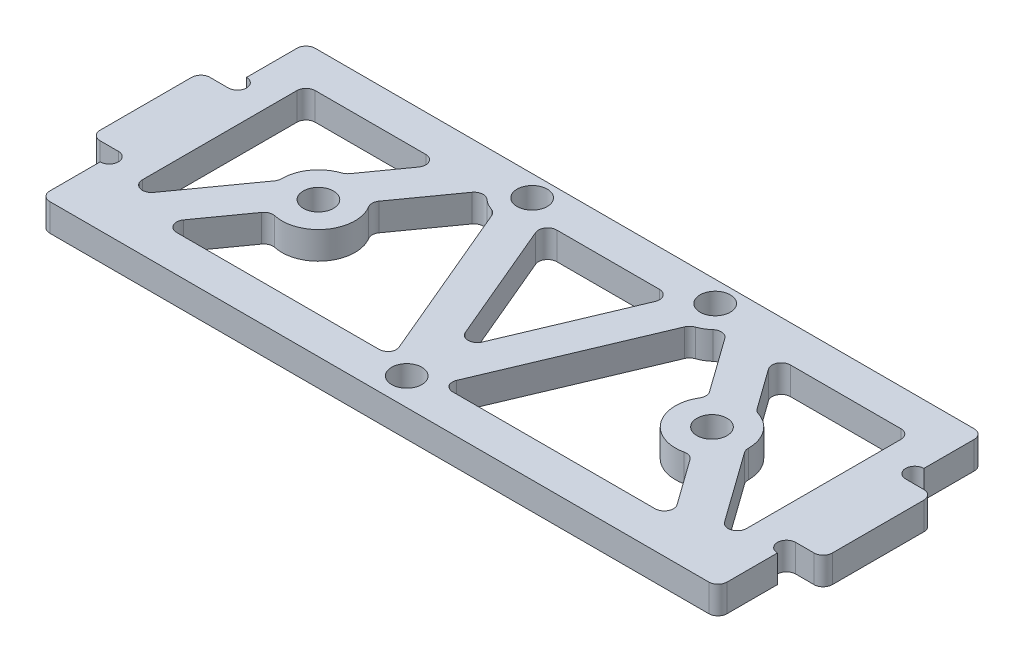
from build123d import *

# Parameters (mm, degrees)
SKETCH_3_R          = 1.65
EXTRUDE_6_DEPTH     = 3
SKETCH_4_R          = 1
CUT_EXTRUDE_1_DEPTH = 50.497474683
FILLET_1_R          = 1


with BuildPart() as part:
    # 草图3 → 凸台-拉伸6 (new body)
    with BuildSketch(Plane(origin=(0, 0, 0), x_dir=(1, 0, 0), z_dir=(0, 1, 0))):
        Polygon((-37, -20.5), (-40, -20.5), (-40, -8.5), (-37, -8.5), (-37, 0), (37, 0), (37, -8.5), (40, -8.5), (40, -20.5), (37, -20.5), (37, -29), (-37, -29), align=None)
        with Locations(Location((-10, -2.3, 0), (0, 0, 270))):
            Circle(SKETCH_3_R, mode=Mode.SUBTRACT)
        with Locations(Location((10, -2.3, 0), (0, 0, 270))):
            Circle(SKETCH_3_R, mode=Mode.SUBTRACT)
        with Locations(Location((0, -26, 0), (0, 0, 270))):
            Circle(SKETCH_3_R, mode=Mode.SUBTRACT)
        with Locations(Location((-21.5, -14.15, 0), (0, 0, 270))):
            Circle(SKETCH_3_R, mode=Mode.SUBTRACT)
        with Locations(Location((21.5, -14.15, 0), (0, 0, 90))):
            Circle(SKETCH_3_R, mode=Mode.SUBTRACT)
    extrude(amount=EXTRUDE_6_DEPTH)

    # 草图4 → 切除-拉伸1 (cut, through all)
    with BuildSketch(Plane(origin=(0, 3, 0), x_dir=(1, 0, 0), z_dir=(0, 1, 0))):
        with Locations((-37, -7.5)):
            Circle(SKETCH_4_R)
        with Locations((-37, -21.5)):
            Circle(SKETCH_4_R)
        with Locations((37, -21.5)):
            Circle(SKETCH_4_R)
        with Locations((37, -7.5)):
            Circle(SKETCH_4_R)
        with BuildLine():
            Line((-33, -4), (-17.977516568, -4))
            Line((-17.977516568, -4), (-22.460716028, -10.267085539))
            ThreePointArc((-22.460716028, -10.267085539), (-24.753285657, -11.822741434), (-25.485103536, -14.494891011))
            Line((-25.485103536, -14.494891011), (-33, -25))
            Line((-33, -25), (-33, -4))
        make_face()
        with BuildLine():
            Line((-28.08189514, -25), (-22.978936608, -17.866550351))
            ThreePointArc((-22.978936608, -17.866550351), (-18.246714343, -16.477258566), (-18.460311642, -11.549943331))
            Line((-18.460311642, -11.549943331), (-13.059411708, -4))
            ThreePointArc((-13.059411708, -4), (-12.079761561, -5.115065159), (-10.726079501, -5.723858723))
            Line((-10.726079501, -5.723858723), (-2.959290121, -24.131149556))
            ThreePointArc((-2.959290121, -24.131149556), (-3.186448679, -24.552054968), (-3.354101966, -25))
            Line((-3.354101966, -25), (-28.08189514, -25))
        make_face()
        Polygon((-7.111954792, -4), (7.111954792, -4), (0, -20.855332858), align=None)
        with BuildLine():
            Line((33, -25), (33, -4))
            Line((33, -4), (17.977516568, -4))
            Line((17.977516568, -4), (22.460716028, -10.267085539))
            ThreePointArc((22.460716028, -10.267085539), (24.753285657, -11.822741434), (25.485103536, -14.494891011))
            Line((25.485103536, -14.494891011), (33, -25))
        make_face()
        with BuildLine():
            Line((3.354101966, -25), (28.08189514, -25))
            Line((28.08189514, -25), (22.978936608, -17.866550351))
            ThreePointArc((22.978936608, -17.866550351), (18.246714343, -16.477258566), (18.460311642, -11.549943331))
            Line((18.460311642, -11.549943331), (13.059411708, -4))
            ThreePointArc((13.059411708, -4), (12.079761561, -5.115065159), (10.726079501, -5.723858723))
            Line((10.726079501, -5.723858723), (2.959290121, -24.131149556))
            ThreePointArc((2.959290121, -24.131149556), (3.186448679, -24.552054968), (3.354101966, -25))
        make_face()
    extrude(amount=-CUT_EXTRUDE_1_DEPTH, mode=Mode.SUBTRACT)

    # 圆角1
    # the kernel refuses this fillet: 1 mm, written as the material it adds along each edge
    with BuildSketch(Plane(origin=(17.977516568, 3, 4), x_dir=(1, 0, 0), z_dir=(0, -1, 0)), Plane(origin=(-28.08189514, 3, 25), x_dir=(0.5818146414920115, 0, -0.8133214142917436), z_dir=(0, -1, 0)), Plane(origin=(-17.977516568, 3, 4), x_dir=(-0.5818146414920105, 0, 0.8133214142917444), z_dir=(0, -1, 0))) as fillet_1_piece_1:
        with BuildLine():
            CenterArc((FILLET_1_R * 1.94488256881, FILLET_1_R), FILLET_1_R, 144.421723672, 125.578276328)
            Line((FILLET_1_R * 1.13156115451, FILLET_1_R * 1.58181464149), (0, 0))
            Line((0, 0), (FILLET_1_R * 1.94488256881, 0))
        make_face()
    extrude(amount=3)
    with BuildSketch(Plane(origin=(33, 3, 4), x_dir=(-1, 0, 0), z_dir=(0, -1, 0)), Plane(origin=(-33, 3, 4), x_dir=(0, 0, 1), z_dir=(0, -1, 0))) as fillet_1_piece_2:
        with BuildLine():
            CenterArc((FILLET_1_R, -FILLET_1_R), FILLET_1_R, 90, 90)
            Line((0, -FILLET_1_R), (0, 0))
            Line((0, 0), (FILLET_1_R, 0))
        make_face()
    extrude(amount=3)
    with BuildSketch(Plane(origin=(2.959290121, 3, 24.131149556), x_dir=(0.38875206983693955, 0, -0.9213424055135502), z_dir=(0, -1, 0))) as fillet_1_piece_3:
        with BuildLine():
            CenterArc((0.481820643, 1), FILLET_1_R, 221.810314896, 48.189685104)
            ThreePointArc((-0.26353535, 0.333333333), (-0.126704365, 0.17066975), (0, 0))
            Line((0, 0), (0.481820643, 0))
        make_face()
    extrude(amount=3)
    with BuildSketch(Plane(origin=(10.726079501, 3, 5.723858723), x_dir=(-0.38875206983694, 0, 0.92134240551355), z_dir=(0, -1, 0)), Plane(origin=(-2.959290121, 3, 24.131149556), x_dir=(-0.38875206983693955, 0, -0.9213424055135502), z_dir=(0, -1, 0))) as fillet_1_piece_4:
        with BuildLine():
            CenterArc((0.481820643, -1), FILLET_1_R, 90, 48.189685104)
            ThreePointArc((-0.26353535, -0.333333333), (-0.126704365, -0.17066975), (0, 0))
            Line((0, 0), (0.481820643, 0))
        make_face()
    extrude(amount=3)
    with BuildSketch(Plane(origin=(13.059411708, 3, 4), x_dir=(-0.6232784406716191, 0, 0.7819999906610966), z_dir=(0, -1, 0))) as fillet_1_piece_5:
        with BuildLine():
            CenterArc((1.319920856, -0.986295222), FILLET_1_R, 99.496659768, 96.369123068)
            Line((0.358016109, -1.259680038), (0, 0))
            ThreePointArc((0, 0), (0.577465375, -0.047966724), (1.154930749, 0))
        make_face()
    extrude(amount=3)
    with BuildSketch(Plane(origin=(18.460311642, 3, 11.549943331), x_dir=(-0.5818146414920088, 0, -0.8133214142917455), z_dir=(0, -1, 0)), Plane(origin=(-22.978936608, 3, 17.866550351), x_dir=(-0.581814641492012, 0, 0.8133214142917432), z_dir=(0, -1, 0))) as fillet_1_piece_6:
        with BuildLine():
            CenterArc((0.716825297, -1), FILLET_1_R, 90, 66.927317505)
            ThreePointArc((-0.203183154, -0.608101481), (-0.089388104, -0.308128251), (0, 0))
            Line((0, 0), (0.716825297, 0))
        make_face()
    extrude(amount=3)
    with BuildSketch(Plane(origin=(22.978936608, 3, 17.866550351), x_dir=(-0.9557806548183481, 0, 0.29408049897096183), z_dir=(0, -1, 0)), Plane(origin=(-18.460311642, 3, 11.549943331), x_dir=(0.5870204705662555, 0, 0.8095720889063382), z_dir=(0, -1, 0))) as fillet_1_piece_7:
        with BuildLine():
            CenterArc((0.721291541, -0.996783336), FILLET_1_R, 94.59681443, 66.927317505)
            Line((-0.227165673, -0.679878124), (0, 0))
            ThreePointArc((0, 0), (0.320574018, -0.012866657), (0.641148037, 0))
        make_face()
    extrude(amount=3)
    with BuildSketch(Plane(origin=(28.08189514, 3, 25), x_dir=(-0.5818146414920125, 0, -0.813321414291743), z_dir=(0, -1, 0))) as fillet_1_piece_8:
        with BuildLine():
            CenterArc((FILLET_1_R * 1.94488256881, -FILLET_1_R), FILLET_1_R, 90, 125.578276328)
            Line((FILLET_1_R * 1.13156115451, -FILLET_1_R * 1.58181464149), (0, 0))
            Line((0, 0), (FILLET_1_R * 1.94488256881, 0))
        make_face()
    extrude(amount=3)
    with BuildSketch(Plane(origin=(3.354101966, 3, 25), x_dir=(1, 0, 0), z_dir=(0, -1, 0))) as fillet_1_piece_9:
        with BuildLine():
            CenterArc((0.677026908, -1), FILLET_1_R, 90, 63.612200039)
            ThreePointArc((-0.218779509, -0.555555556), (-0.09752127, -0.282451624), (0, 0))
            Line((0, 0), (0.677026908, 0))
        make_face()
    extrude(amount=3)
    with BuildSketch(Plane(origin=(-13.059411708, 3, 4), x_dir=(-0.5818146414920109, 0, 0.8133214142917442), z_dir=(0, -1, 0))) as fillet_1_piece_10:
        with BuildLine():
            CenterArc((1.309568376, -1), FILLET_1_R, 90, 96.369123068)
            ThreePointArc((0.31574053, -1.11093337), (0.204009684, -0.542353311), (0, 0))
            Line((0, 0), (1.309568376, 0))
        make_face()
    extrude(amount=3)
    with BuildSketch(Plane(origin=(-10.726079501, 3, 5.723858723), x_dir=(-0.9638482393906854, 0, -0.26645181820260827), z_dir=(0, -1, 0))) as fillet_1_piece_11:
        with BuildLine():
            CenterArc((0.485629561, -0.99815583), FILLET_1_R, 93.480205158, 48.189685104)
            Line((-0.298820999, -0.377964473), (0, 0))
            ThreePointArc((0, 0), (0.212462933, -0.006454594), (0.424925866, 0))
        make_face()
    extrude(amount=3)
    with BuildSketch(Plane(origin=(-3.354101966, 3, 25), x_dir=(0.3664147496948947, 0, -0.9304516275476269), z_dir=(0, -1, 0))) as fillet_1_piece_12:
        with BuildLine():
            CenterArc((0.682378983, -0.996355538), FILLET_1_R, 94.893125181, 63.612200039)
            Line((-0.248072645, -0.629940788), (0, 0))
            ThreePointArc((0, 0), (0.298540805, -0.012755617), (0.59708161, 0))
        make_face()
    extrude(amount=3)
    with BuildSketch(Plane(origin=(-7.111954792, 3, 4), x_dir=(0.38875206983694144, 0, 0.9213424055135496), z_dir=(0, -1, 0))) as fillet_1_piece_13:
        with BuildLine():
            CenterArc((FILLET_1_R * 1.507313743, -FILLET_1_R), FILLET_1_R, 90, 112.876871805)
            Line((FILLET_1_R * 0.585971337484, -FILLET_1_R * 1.38875206984), (0, 0))
            Line((0, 0), (FILLET_1_R * 1.507313743, 0))
        make_face()
    extrude(amount=3)
    with BuildSketch(Plane(origin=(7.111954792, 3, 4), x_dir=(-0.38875206983694094, 0, 0.9213424055135497), z_dir=(0, -1, 0))) as fillet_1_piece_14:
        with BuildLine():
            CenterArc((FILLET_1_R * 1.507313743, FILLET_1_R), FILLET_1_R, 157.123128195, 112.876871805)
            Line((FILLET_1_R * 0.585971337484, FILLET_1_R * 1.38875206984), (0, 0))
            Line((0, 0), (FILLET_1_R * 1.507313743, 0))
        make_face()
    extrude(amount=3)
    with BuildSketch(Plane(origin=(0, 3, 20.855332858), x_dir=(0.38875206983694144, 0, -0.9213424055135495), z_dir=(0, -1, 0))) as fillet_1_piece_15:
        with BuildLine():
            CenterArc((FILLET_1_R * 2.37, -FILLET_1_R), FILLET_1_R, 90, 134.246256391)
            Line((FILLET_1_R * 1.65365246566, -FILLET_1_R * 1.69774365639), (0, 0))
            Line((0, 0), (FILLET_1_R * 2.37, 0))
        make_face()
    extrude(amount=3)
    with BuildSketch(Plane(origin=(33, 3, 25), x_dir=(0, 0, -1), z_dir=(0, -1, 0)), Plane(origin=(-33, 3, 25), x_dir=(0.5818146414920113, 0, -0.8133214142917439), z_dir=(0, -1, 0))) as fillet_1_piece_16:
        with BuildLine():
            CenterArc((FILLET_1_R * 3.11666514552, -FILLET_1_R), FILLET_1_R, 90, 144.421723672)
            Line((FILLET_1_R * 2.53485050403, -FILLET_1_R * 1.81332141429), (0, 0))
            Line((0, 0), (FILLET_1_R * 3.11666514552, 0))
        make_face()
    extrude(amount=3)
    with BuildSketch(Plane(origin=(25.485103536, 3, 14.494891011), x_dir=(0.5818146414920119, 0, 0.8133214142917433), z_dir=(0, -1, 0)), Plane(origin=(-22.460716028, 3, 10.267085539), x_dir=(0.5818146414920021, 0, -0.8133214142917503), z_dir=(0, -1, 0))) as fillet_1_piece_17:
        with BuildLine():
            CenterArc((0.346117617, -1), FILLET_1_R, 90, 36.089146464)
            ThreePointArc((-0.242925672, -0.191898519), (-0.11960566, -0.098300271), (0, 0))
            Line((0, 0), (0.346117617, 0))
        make_face()
    extrude(amount=3)
    with BuildSketch(Plane(origin=(22.460716028, 3, 10.267085539), x_dir=(0.9607072883816618, 0, 0.277563517145814), z_dir=(0, -1, 0)), Plane(origin=(-25.485103536, 3, 14.494891011), x_dir=(-0.04760515714824153, 0, -0.99886623179127), z_dir=(0, -1, 0))) as fillet_1_piece_18:
        with BuildLine():
            CenterArc((0.348274134, -0.999250986), FILLET_1_R, 92.217735732, 36.089146464)
            Line((-0.271599158, -0.214549067), (0, 0))
            ThreePointArc((0, 0), (0.154788504, -0.002996057), (0.309577008, 0))
        make_face()
    extrude(amount=3)
    # the kernel refuses this fillet: 1 mm, written as the material it takes off along each edge
    with BuildSketch(Plane(origin=(-37, -2.5, 0), x_dir=(0, 0, 1), z_dir=(0, 1, 0)), Plane(origin=(37, -2.5, 0), x_dir=(-1, 0, 0), z_dir=(0, 1, 0)), Plane(origin=(40, -2.5, 8.5), x_dir=(-1, 0, 0), z_dir=(0, 1, 0)), Plane(origin=(40, -2.5, 20.5), x_dir=(0, 0, -1), z_dir=(0, 1, 0)), Plane(origin=(37, -2.5, 29), x_dir=(0, 0, -1), z_dir=(0, 1, 0)), Plane(origin=(-40, -2.5, 20.5), x_dir=(1, 0, 0), z_dir=(0, 1, 0)), Plane(origin=(-40, -2.5, 8.5), x_dir=(0, 0, 1), z_dir=(0, 1, 0))) as fillet_1_2_piece_1:
        with BuildLine():
            CenterArc((FILLET_1_R, FILLET_1_R), FILLET_1_R, 180, 90)
            Line((0, FILLET_1_R), (0, 0))
            Line((0, 0), (FILLET_1_R, 0))
        make_face()
    extrude(amount=8, mode=Mode.SUBTRACT)
    with BuildSketch(Plane(origin=(-37, -2.5, 29), x_dir=(0, 0, -1), z_dir=(0, 1, 0))) as fillet_1_2_piece_2:
        with BuildLine():
            CenterArc((FILLET_1_R, -FILLET_1_R), FILLET_1_R, 90, 90)
            Line((0, -FILLET_1_R), (0, 0))
            Line((0, 0), (FILLET_1_R, 0))
        make_face()
    extrude(amount=8, mode=Mode.SUBTRACT)


solid = part.part
